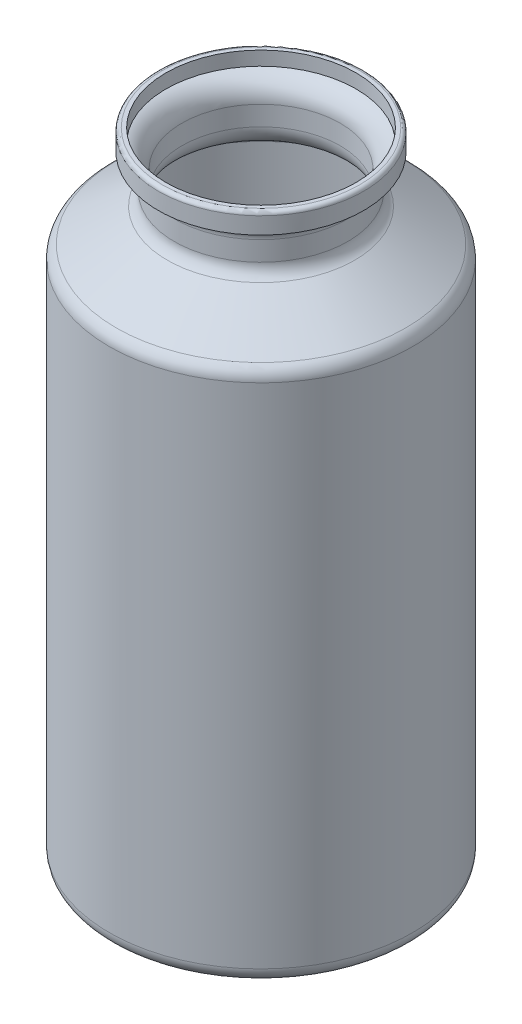
from build123d import *

# Parameters (mm, degrees)
FILLET1_R = 4
FILLET2_R = 1
SHELL1_T  = 2


with BuildPart() as part:
    # Sketch5 → Revolve1 (revolve)
    with BuildSketch(Plane.XY, mode=Mode.PRIVATE) as revolve1_sk:
        Polygon((0, -74.193548387), (40, -74.193548387), (40, 65.806451613), (22.881800616, 76.893293207), (22.881800616, 88.228166712), (27.066984679, 88.228166712), (27.066984679, 93.634029461), (0, 93.634029461), align=None)
    revolve(revolve1_sk.sketch.rotate(Axis((0, -74.193548387, 0), (0, 1, 0)), 90), axis=Axis((0, -74.193548387, 0), (0, 1, 0)))

    # Fillet1
    fillet1_edges = [part.edges().sort_by_distance(p)[0] for p in [
        (0, 65.806451613, 40),
        (0, -74.193548387, 40),
        (0, 88.228166712, 22.881800616),
        (0, 76.893293207, 22.881800616),
    ]]
    fillet(fillet1_edges, radius=FILLET1_R)

    # Fillet2
    fillet2_edges = [part.edges().sort_by_distance(p)[0] for p in [
        (0, 93.634029461, 27.066984679),
    ]]
    fillet(fillet2_edges, radius=FILLET2_R)

    # Shell1
    # the kernel refuses this shell: the inside is offset whole and opened at the faces by hand
    shell1_offset = offset(amount=-SHELL1_T, mode=Mode.PRIVATE)
    shell1_offset = shell1_offset + extrude(shell1_offset.faces().sort_by_distance((0, 91.634029, 0))[0], amount=SHELL1_T, mode=Mode.PRIVATE)
    add(shell1_offset, mode=Mode.SUBTRACT)


solid = part.part
